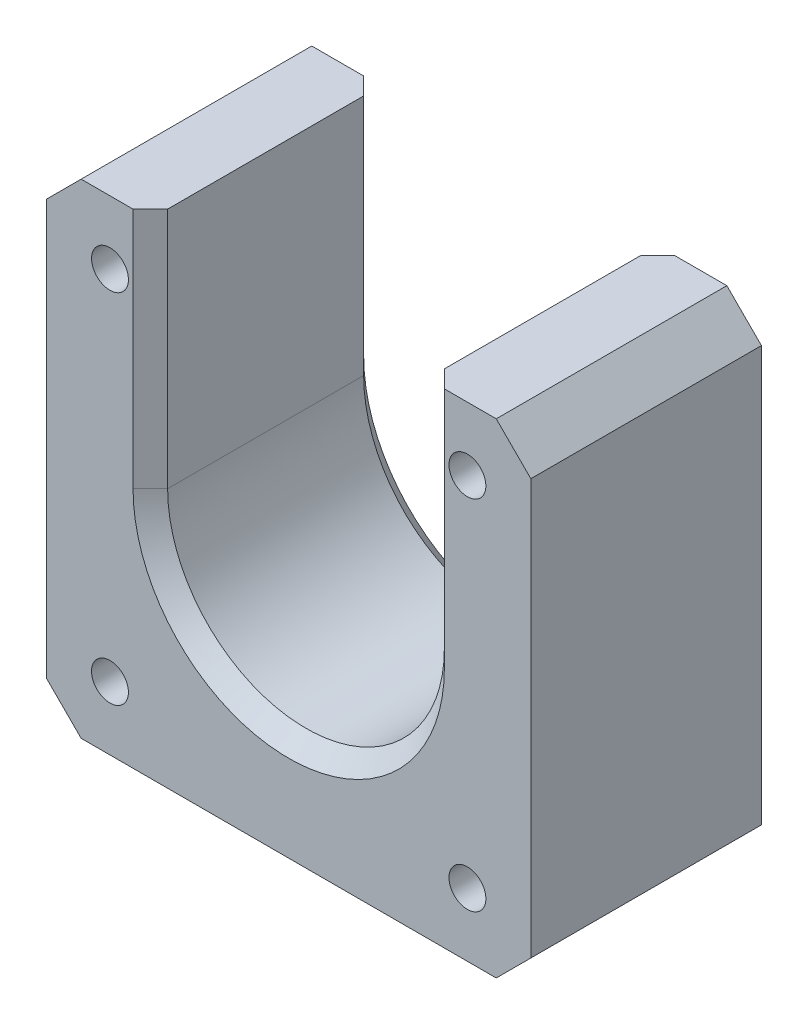
from build123d import *

# Parameters (mm, degrees)
SKETCH1_W           = 42
SKETCH1_H           = 42
BOSS_EXTRUDE1_DEPTH = 20
SKETCH2_R           = 1.6
CUT_EXTRUDE1_DEPTH  = 30
CHAMFER1_SIZE       = 3
CHAMFER2_SIZE       = 3
CHAMFER3_SIZE       = 3
CHAMFER4_SIZE       = 3
CHAMFER6_SIZE       = 1.5


with BuildPart() as part:
    # Sketch1 → Boss-Extrude1 (new body)
    with BuildSketch(Plane.XY):
        Rectangle(SKETCH1_W, SKETCH1_H)
    extrude(amount=BOSS_EXTRUDE1_DEPTH)

    # Sketch2 → Cut-Extrude1 (cut)
    with BuildSketch(Plane.XY.offset(20)):
        with Locations((-15.5, 15.5)):
            Circle(SKETCH2_R)
        with Locations((15.5, -15.5)):
            Circle(SKETCH2_R)
        with Locations((15.5, 15.5)):
            Circle(SKETCH2_R)
        with Locations((-15.5, -15.5)):
            Circle(SKETCH2_R)
        with BuildLine():
            Line((-12, 0), (-12, 21))
            Line((-12, 21), (12, 21))
            Line((12, 21), (12, 0))
            ThreePointArc((12, 0), (0, -12), (-12, 0))
        make_face()
    extrude(amount=-CUT_EXTRUDE1_DEPTH, mode=Mode.SUBTRACT)

    # Chamfer1
    chamfer1_edges = [part.edges().sort_by_distance(p)[0] for p in [
        (-21, 21, 10),
    ]]
    chamfer(chamfer1_edges, length=CHAMFER1_SIZE)

    # Chamfer2
    chamfer2_edges = [part.edges().sort_by_distance(p)[0] for p in [
        (21, 21, 10),
    ]]
    chamfer(chamfer2_edges, length=CHAMFER2_SIZE)

    # Chamfer3
    chamfer3_edges = [part.edges().sort_by_distance(p)[0] for p in [
        (21, -21, 10),
    ]]
    chamfer(chamfer3_edges, length=CHAMFER3_SIZE)

    # Chamfer4
    chamfer4_edges = [part.edges().sort_by_distance(p)[0] for p in [
        (-21, -21, 10),
    ]]
    chamfer(chamfer4_edges, length=CHAMFER4_SIZE)

    # Chamfer6
    chamfer6_edges = [part.edges().sort_by_distance(p)[0] for p in [
        (-12, 10.5, 0),
        (12, 10.5, 0),
        (0, -12, 0),
        (-12, 10.5, 20),
        (12, 10.5, 20),
        (0, -12, 20),
    ]]
    chamfer(chamfer6_edges, length=CHAMFER6_SIZE)


solid = part.part
